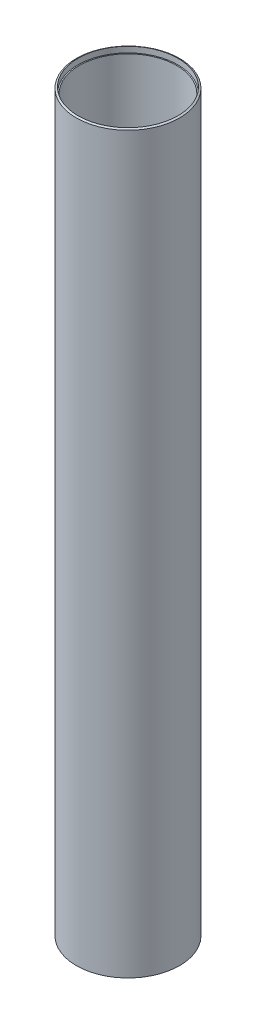
from build123d import *


with BuildPart() as part:
    # Sketch2 → Revolve1 (revolve)
    with BuildSketch(Plane.XY):
        Polygon((-57.15, 1.099852263), (-57.15, 813.899852263), (-55.245, 814.999704526), (-55.245, 808.649704526), (-53.975, 808.649704526), (-53.975, 6.35), (-55.245, 6.35), (-55.245, 0), align=None)
    revolve(axis=Axis((0, 819.187021794, 0), (0, -1, 0)))


solid = part.part
